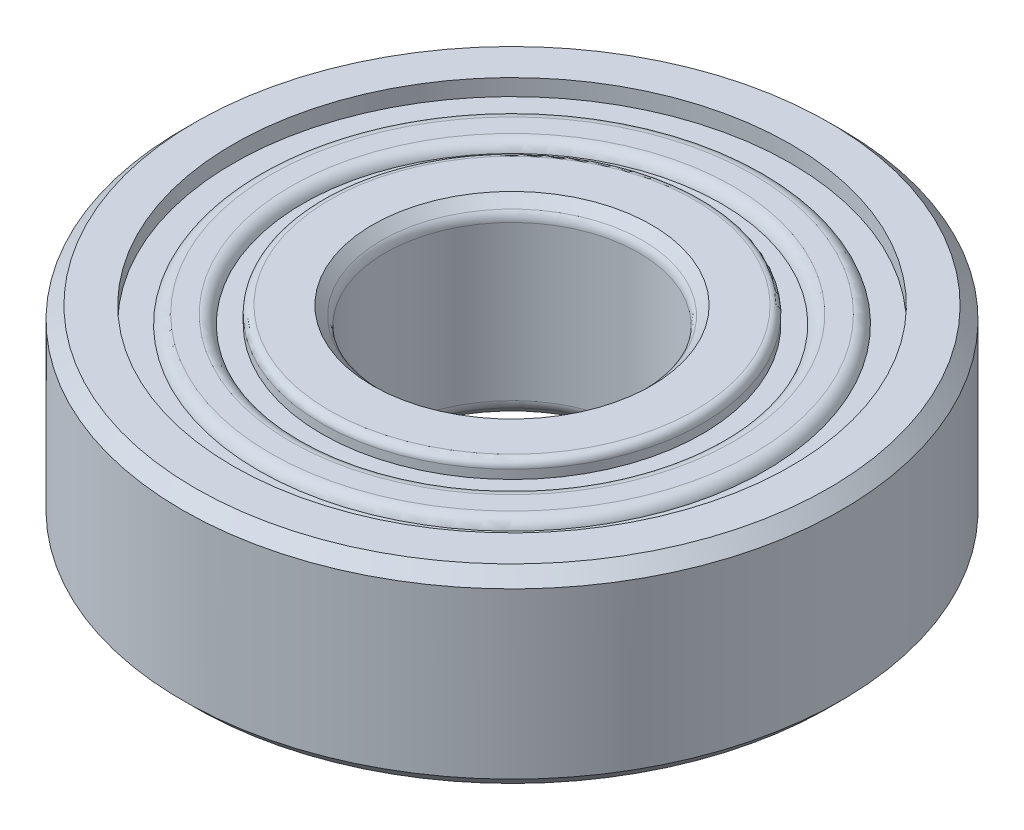
from build123d import *

# Parameters (mm, degrees)
SKETCH1_R                = 26
BOSS_EXTRUDE1_DEPTH      = 7.5
SKETCH2_R                = 22
CUT_EXTRUDE1_DEPTH       = 1.3
SKETCH3_R                = 20
SKETCH3_R_2              = 16.5
BOSS_EXTRUDE2_DEPTH      = 0.7
SKETCH4_R                = 15
SKETCH4_R_2              = 10
BOSS_EXTRUDE3_DEPTH      = 1.3
SKETCH5_R                = 10
CUT_EXTRUDE2_DEPTH       = 38.288604157
CHAMFER1_SIZE            = 1
CHAMFER2_SIZE            = 1
FILLET1_R                = 1
FILLET2_R                = 1
FILLET3_R                = 0.6
CHAMFER1_OF_MIRROR2_SIZE = 1
CHAMFER2_OF_MIRROR2_SIZE = 1
FILLET1_OF_MIRROR2_R     = 1
FILLET2_OF_MIRROR2_R     = 1
FILLET3_OF_MIRROR2_R     = 0.6


with BuildPart() as part:
    # Sketch1 → Boss-Extrude1 (new body)
    with BuildSketch(Plane(origin=(0, 0, 0), x_dir=(1, 0, 0), z_dir=(0, 1, 0))):
        with Locations(Location((0, 0, 0), (0, 0, 270))):
            Circle(SKETCH1_R)
    boss_extrude1 = extrude(amount=BOSS_EXTRUDE1_DEPTH)

    # Sketch2 → Cut-Extrude1 (cut)
    with BuildSketch(Plane(origin=(0, 7.5, 0), x_dir=(1, 0, 0), z_dir=(0, 1, 0))):
        with Locations(Location((0, 0, 0), (0, 0, 270))):
            Circle(SKETCH2_R)
    cut_extrude1 = extrude(amount=-CUT_EXTRUDE1_DEPTH, mode=Mode.SUBTRACT)

    # Sketch3 → Boss-Extrude2 (add)
    with BuildSketch(Plane(origin=(0, 6.2, 0), x_dir=(1, 0, 0), z_dir=(0, 1, 0))):
        with Locations(Location((0, 0, 0), (0, 0, 270))):
            Circle(SKETCH3_R)
        with Locations(Location((0, 0, 0), (0, 0, 270))):
            Circle(SKETCH3_R_2, mode=Mode.SUBTRACT)
    boss_extrude2 = extrude(amount=BOSS_EXTRUDE2_DEPTH)

    # Sketch4 → Boss-Extrude3 (add)
    with BuildSketch(Plane(origin=(0, 6.2, 0), x_dir=(1, 0, 0), z_dir=(0, 1, 0))):
        with Locations(Location((0, 0, 0), (0, 0, 270))):
            Circle(SKETCH4_R)
        with Locations(Location((0, 0, 0), (0, 0, 270))):
            Circle(SKETCH4_R_2, mode=Mode.SUBTRACT)
    boss_extrude3 = extrude(amount=BOSS_EXTRUDE3_DEPTH)

    # Sketch5 → Cut-Extrude2 (cut, through all)
    with BuildSketch(Plane(origin=(0, 6.2, 0), x_dir=(1, 0, 0), z_dir=(0, 1, 0))):
        with Locations(Location((0, 0, 0), (0, 0, 270))):
            Circle(SKETCH5_R)
    cut_extrude2 = extrude(amount=-CUT_EXTRUDE2_DEPTH, mode=Mode.SUBTRACT)

    # Chamfer1
    chamfer1_edges = [part.edges().sort_by_distance(p)[0] for p in [
        (0, 7.5, -26),
    ]]
    chamfer(chamfer1_edges, length=CHAMFER1_SIZE)

    # Chamfer2
    chamfer2_edges = [part.edges().sort_by_distance(p)[0] for p in [
        (0, 7.5, -10),
    ]]
    chamfer(chamfer2_edges, length=CHAMFER2_SIZE)

    # Fillet1
    # the kernel refuses this fillet: 1 mm, written as the material it takes off along each edge
    with BuildSketch(Plane(origin=(0, 6.9, 0), x_dir=(0, 0, 1), z_dir=(-1, 0, 0))) as fillet1_piece_1:
        with BuildLine():
            CenterArc((19.046060799, -1), FILLET1_R, 17.457603124, 72.542396876)
            Line((20, -0.7), (20.019078784, -0.694))
            ThreePointArc((20.019078784, -0.694), (20.02, -0.35), (20.02, 0))
            Line((20.02, 0), (20, 0.02))
            Line((20, 0.02), (19.046060799, 0.02))
            Line((19.046060799, 0.02), (19.046060799, 0))
        make_face()
    revolve(axis=Axis((0, 6.9, 0), (0, 1, 0)), mode=Mode.SUBTRACT)
    with BuildSketch(Plane(origin=(0, 6.9, 0), x_dir=(0, 0, 1), z_dir=(-1, 0, 0))) as fillet1_piece_2:
        with BuildLine():
            CenterArc((17.453939201, -1), FILLET1_R, 90, 72.542396876)
            Line((17.453939201, 0), (17.453939201, 0.02))
            Line((17.453939201, 0.02), (16.5, 0.02))
            Line((16.5, 0.02), (16.48, 0))
            ThreePointArc((16.48, 0), (16.48, -0.35), (16.480921216, -0.694))
            Line((16.480921216, -0.694), (16.5, -0.7))
        make_face()
    revolve(axis=Axis((0, 6.9, 0), (0, 1, 0)), mode=Mode.SUBTRACT)

    # Fillet2
    fillet2_edges = [part.edges().sort_by_distance(p)[0] for p in [
        (0, 6.5, -10),
    ]]
    fillet(fillet2_edges, radius=FILLET2_R)

    # Fillet3
    fillet3_edges = [part.edges().sort_by_distance(p)[0] for p in [
        (0, 7.5, -15),
    ]]
    fillet(fillet3_edges, radius=FILLET3_R)

    # Mirror2: Boss-Extrude1, Cut-Extrude1, Boss-Extrude2, Boss-Extrude3, Cut-Extrude2 across Top Plane
    add(boss_extrude1.mirror(Plane(origin=(0, 0, 0), x_dir=(1, 0, 0), z_dir=(0, 1, 0))))
    add(cut_extrude1.mirror(Plane(origin=(0, 0, 0), x_dir=(1, 0, 0), z_dir=(0, 1, 0))), mode=Mode.SUBTRACT)
    add(boss_extrude2.mirror(Plane(origin=(0, 0, 0), x_dir=(1, 0, 0), z_dir=(0, 1, 0))))
    add(boss_extrude3.mirror(Plane(origin=(0, 0, 0), x_dir=(1, 0, 0), z_dir=(0, 1, 0))))
    add(cut_extrude2.mirror(Plane(origin=(0, 0, 0), x_dir=(1, 0, 0), z_dir=(0, 1, 0))), mode=Mode.SUBTRACT)

    # Chamfer1 of Mirror2
    chamfer1_of_mirror2_edges = [part.edges().sort_by_distance(p)[0] for p in [
        (0, -7.5, -26),
    ]]
    chamfer(chamfer1_of_mirror2_edges, length=CHAMFER1_OF_MIRROR2_SIZE)

    # Chamfer2 of Mirror2
    chamfer2_of_mirror2_edges = [part.edges().sort_by_distance(p)[0] for p in [
        (0, -7.5, -10),
    ]]
    chamfer(chamfer2_of_mirror2_edges, length=CHAMFER2_OF_MIRROR2_SIZE)

    # Fillet1 of Mirror2
    # the kernel refuses this fillet: 1 mm, written as the material it takes off along each edge
    with BuildSketch(Plane(origin=(0, -6.9, 0), x_dir=(0, 0, 1), z_dir=(-1, 0, 0))) as fillet1_of_mirror2_piece_1:
        with BuildLine():
            CenterArc((19.046060799, 1), FILLET1_OF_MIRROR2_R, 270, 72.542396876)
            Line((20, 0.7), (20.019078784, 0.694))
            ThreePointArc((20.019078784, 0.694), (20.02, 0.35), (20.02, 0))
            Line((20.02, 0), (20, -0.02))
            Line((20, -0.02), (19.046060799, -0.02))
            Line((19.046060799, -0.02), (19.046060799, 0))
        make_face()
    revolve(axis=Axis((0, -6.9, 0), (0, 1, 0)), mode=Mode.SUBTRACT)
    with BuildSketch(Plane(origin=(0, -6.9, 0), x_dir=(0, 0, 1), z_dir=(-1, 0, 0))) as fillet1_of_mirror2_piece_2:
        with BuildLine():
            CenterArc((17.453939201, 1), FILLET1_OF_MIRROR2_R, 197.457603124, 72.542396876)
            Line((17.453939201, 0), (17.453939201, -0.02))
            Line((17.453939201, -0.02), (16.5, -0.02))
            Line((16.5, -0.02), (16.48, 0))
            ThreePointArc((16.48, 0), (16.48, 0.35), (16.480921216, 0.694))
            Line((16.480921216, 0.694), (16.5, 0.7))
        make_face()
    revolve(axis=Axis((0, -6.9, 0), (0, 1, 0)), mode=Mode.SUBTRACT)

    # Fillet2 of Mirror2
    fillet2_of_mirror2_edges = [part.edges().sort_by_distance(p)[0] for p in [
        (0, -6.5, -10),
    ]]
    fillet(fillet2_of_mirror2_edges, radius=FILLET2_OF_MIRROR2_R)

    # Fillet3 of Mirror2
    fillet3_of_mirror2_edges = [part.edges().sort_by_distance(p)[0] for p in [
        (0, -7.5, -15),
    ]]
    fillet(fillet3_of_mirror2_edges, radius=FILLET3_OF_MIRROR2_R)


solid = part.part
